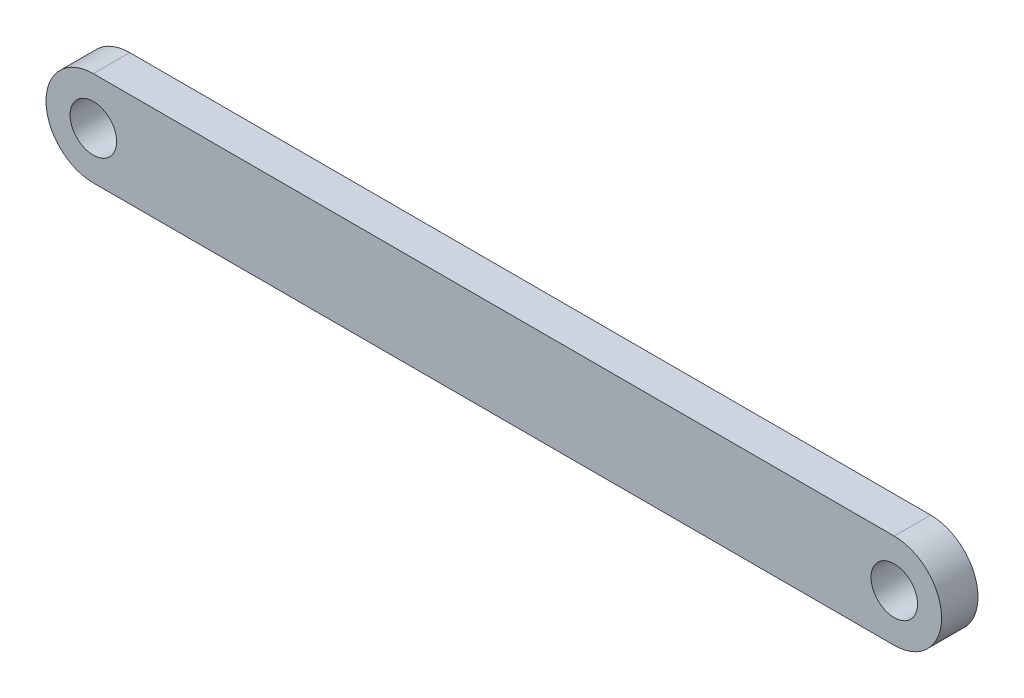
from build123d import *

# Parameters (mm, degrees)
SKETCH1_R           = 1.6
BOSS_EXTRUDE1_DEPTH = 2.5


with BuildPart() as part:
    # Sketch1 → Boss-Extrude1 (new body)
    with BuildSketch(Plane.XY):
        with BuildLine():
            Line((-55, 3.25), (0, 3.25))
            ThreePointArc((0, 3.25), (3.25, 0), (0, -3.25))
            Line((0, -3.25), (-55, -3.25))
            ThreePointArc((-55, -3.25), (-58.25, 0), (-55, 3.25))
        make_face()
        with Locations((-55, 0)):
            Circle(SKETCH1_R, mode=Mode.SUBTRACT)
        Circle(SKETCH1_R, mode=Mode.SUBTRACT)
    extrude(amount=BOSS_EXTRUDE1_DEPTH)


solid = part.part
